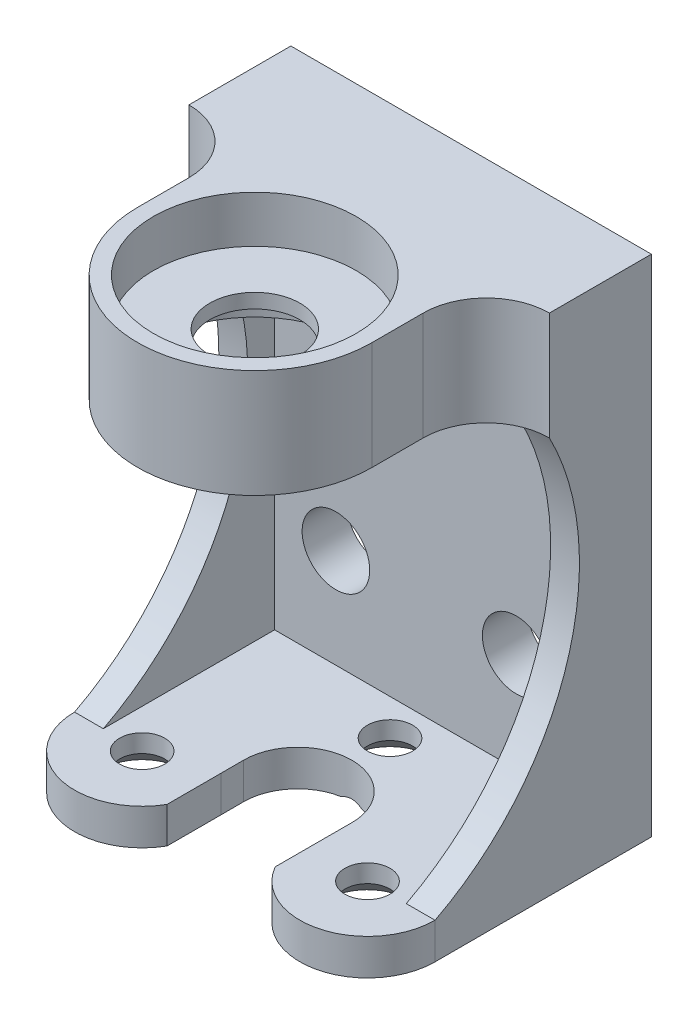
from build123d import *

# Parameters (mm, degrees)
SKETCH1_W           = 25.4
SKETCH1_H           = 35.56
SKETCH1_R           = 2.38125
BOSS_EXTRUDE1_DEPTH = 3.175
SKETCH7_W           = 25.4
SKETCH7_H           = 2.54
SKETCH7_H_2         = 7.62
BOSS_EXTRUDE3_DEPTH = 20.32
SKETCH11_R          = 1.5875
CUT_EXTRUDE1_DEPTH  = 10
CHAMFER2_SIZE       = 1.27
SKETCH13_R          = 3.175
CUT_EXTRUDE2_DEPTH  = 12.7
SKETCH14_R          = 7.14375
CUT_EXTRUDE3_DEPTH  = 3.302
CUT_EXTRUDE4_START  = -3.302
SKETCH15_R          = 7.14375
CUT_EXTRUDE4_DEPTH  = 3.302
CUT_EXTRUDE5_DEPTH  = 12.7
SKETCH17_W          = 2.029010409
SKETCH17_H          = 25.4
BOSS_EXTRUDE4_DEPTH = 12.7
CUT_EXTRUDE6_DEPTH  = 46.281333074


with BuildPart() as part:
    # Sketch1 → Boss-Extrude1 (new body)
    with BuildSketch(Plane.XY):
        with Locations((0, 11.43)):
            Rectangle(SKETCH1_W, SKETCH1_H)
        with Locations((-6.35, 3.175)):
            Circle(SKETCH1_R, mode=Mode.SUBTRACT)
        with Locations(Location((6.35, 3.175, 0), (0, 0, 180))):
            Circle(SKETCH1_R, mode=Mode.SUBTRACT)
    extrude(amount=BOSS_EXTRUDE1_DEPTH)

    # Sketch7 → Boss-Extrude3 (add)
    with BuildSketch(Plane.XY.offset(3.175)):
        with Locations((0, -5.08)):
            Rectangle(SKETCH7_W, SKETCH7_H)
        with Locations((0, 25.4)):
            Rectangle(SKETCH7_W, SKETCH7_H_2)
    extrude(amount=BOSS_EXTRUDE3_DEPTH)

    # Sketch11 → Cut-Extrude1 (cut)
    with BuildSketch(Plane.XZ.offset(6.35)):
        with Locations((-7.9375, 15.24)):
            Circle(SKETCH11_R)
        with Locations((7.9375, 15.24)):
            Circle(SKETCH11_R)
        with Locations((0, 5.715)):
            Circle(SKETCH11_R)
        with BuildLine():
            Line((-3.814625586, 12.241539102), (-3.814692285, 12.218981082))
            ThreePointArc((-3.814692285, 12.218981082), (0, 8.404288797), (3.814692285, 12.218981082))
            Line((3.814692285, 12.218981082), (3.814625586, 12.241539102))
            Line((3.814625586, 12.241539102), (3.81, 13.805952441))
            Line((3.81, 13.805952441), (3.81, 17.615952441))
            ThreePointArc((3.81, 17.615952441), (9.167172212, 19.841012117), (12.7, 15.24))
            Line((12.7, 15.24), (12.7, 23.495))
            Line((12.7, 23.495), (-12.7, 23.495))
            Line((-12.7, 23.495), (-12.7, 15.24))
            ThreePointArc((-12.7, 15.24), (-9.167172212, 19.841012117), (-3.81, 17.615952441))
            Line((-3.81, 17.615952441), (-3.81, 13.805952441))
            Line((-3.81, 13.805952441), (-3.814625586, 12.241539102))
        make_face()
    extrude(amount=-CUT_EXTRUDE1_DEPTH, mode=Mode.SUBTRACT)

    # Chamfer2
    # the kernel refuses this chamfer: 1.27 mm, written as the material it takes off along each edge
    with BuildSketch(Plane(origin=(-7.9375, -6.35, 15.24), x_dir=(1, 0, 0), z_dir=(0, 0, -1))) as chamfer2_piece_1:
        Polygon((1.5875 + CHAMFER2_SIZE, 0), (1.5875, -CHAMFER2_SIZE), (1.5875, 0), align=None)
    revolve(axis=Axis((-7.9375, -6.35, 15.24), (0, -1, 0)), mode=Mode.SUBTRACT)
    with BuildSketch(Plane(origin=(7.9375, -6.35, 15.24), x_dir=(1, 0, 0), z_dir=(0, 0, -1))) as chamfer2_piece_2:
        Polygon((1.5875 + CHAMFER2_SIZE, 0), (1.5875, -CHAMFER2_SIZE), (1.5875, 0), align=None)
    revolve(axis=Axis((7.9375, -6.35, 15.24), (0, -1, 0)), mode=Mode.SUBTRACT)
    with BuildSketch(Plane(origin=(0, -6.35, 5.715), x_dir=(1, 0, 0), z_dir=(0, 0, -1))) as chamfer2_piece_3:
        Polygon((1.5875 + CHAMFER2_SIZE, 0), (1.5875, -CHAMFER2_SIZE), (1.5875, 0), align=None)
    revolve(axis=Axis((0, -6.35, 5.715), (0, -1, 0)), mode=Mode.SUBTRACT)

    # Sketch13 → Cut-Extrude2 (cut)
    with BuildSketch(Plane(origin=(0, 29.21, 0), x_dir=(1, 0, 0), z_dir=(0, 1, 0))):
        with Locations(Location((0, -15.24, 0), (0, 0, 270))):
            Circle(SKETCH13_R)
    extrude(amount=-CUT_EXTRUDE2_DEPTH, mode=Mode.SUBTRACT)

    # Sketch14 → Cut-Extrude3 (cut)
    with BuildSketch(Plane(origin=(0, 29.21, 0), x_dir=(1, 0, 0), z_dir=(0, 1, 0))):
        with Locations(Location((0, -15.24, 0), (0, 0, 270))):
            Circle(SKETCH14_R)
    extrude(amount=-CUT_EXTRUDE3_DEPTH, mode=Mode.SUBTRACT)

    # Sketch15 → Cut-Extrude4 (cut)
    with BuildSketch(Plane.XZ.offset(-21.59).offset(CUT_EXTRUDE4_START)):
        with Locations(Location((0, 15.24, 0), (0, 0, 90))):
            Circle(SKETCH15_R)
    extrude(amount=CUT_EXTRUDE4_DEPTH, mode=Mode.SUBTRACT)

    # Sketch16 → Cut-Extrude5 (cut)
    with BuildSketch(Plane(origin=(0, 29.21, 0), x_dir=(1, 0, 0), z_dir=(0, 1, 0))):
        with BuildLine():
            ThreePointArc((8.255, -15.24), (5.837166479, -21.077166479), (0, -23.495))
            Line((0, -23.495), (12.7, -23.495))
            Line((12.7, -23.495), (12.7, -7.184415797))
            ThreePointArc((12.7, -7.184415797), (9.556910358, -8.486326154), (8.255, -11.629415797))
            Line((8.255, -11.629415797), (8.255, -15.24))
        make_face()
        with BuildLine():
            ThreePointArc((0, -23.495), (-5.837166479, -21.077166479), (-8.255, -15.24))
            Line((-8.255, -15.24), (-8.255, -11.629415797))
            ThreePointArc((-8.255, -11.629415797), (-9.556910358, -8.486326154), (-12.7, -7.184415797))
            Line((-12.7, -7.184415797), (-12.7, -23.495))
            Line((-12.7, -23.495), (0, -23.495))
        make_face()
    extrude(amount=-CUT_EXTRUDE5_DEPTH, mode=Mode.SUBTRACT)

    # Sketch17 → Boss-Extrude4 (add)
    with BuildSketch(Plane.XY.offset(3.175)):
        with Locations((-11.685494796, 8.89)):
            Rectangle(SKETCH17_W, SKETCH17_H)
        with Locations((11.685494796, 8.89)):
            Rectangle(SKETCH17_W, SKETCH17_H)
    extrude(amount=BOSS_EXTRUDE4_DEPTH)

    # Sketch18 → Cut-Extrude6 (cut, through all)
    with BuildSketch(Plane(origin=(12.7, 0, 0), x_dir=(0, 0, -1), z_dir=(1, 0, 0))):
        with BuildLine():
            ThreePointArc((-7.184415797, 21.59), (-5.951695656, 7.221633885), (-15.24, -3.81))
            Line((-15.24, -3.81), (-15.875, -3.81))
            Line((-15.875, -3.81), (-15.875, 21.59))
            Line((-15.875, 21.59), (-7.184415797, 21.59))
        make_face()
    extrude(amount=-CUT_EXTRUDE6_DEPTH, mode=Mode.SUBTRACT)


solid = part.part
